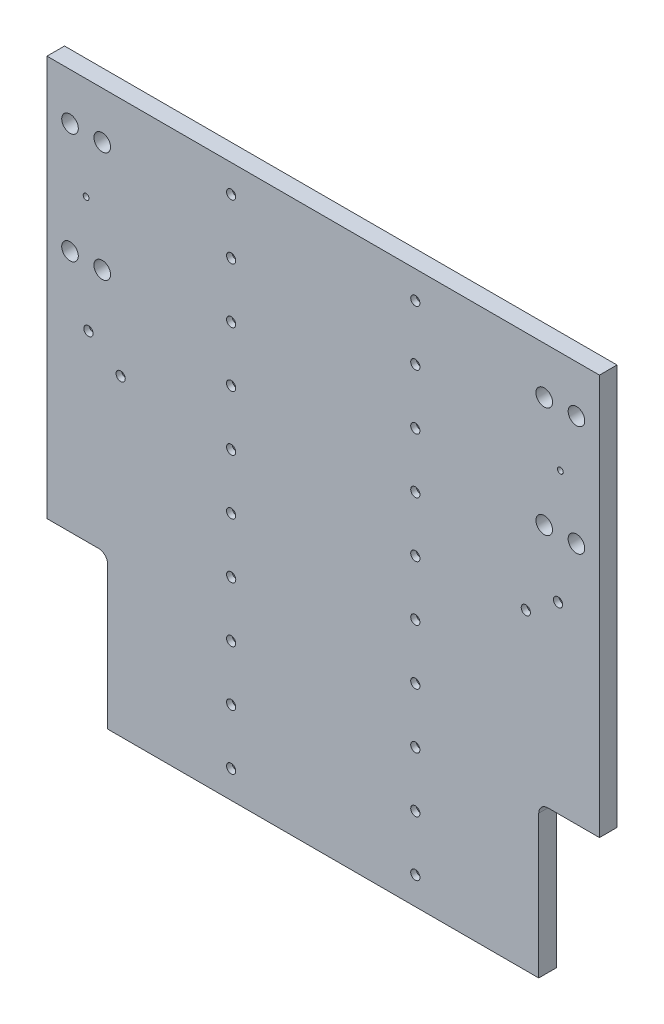
from build123d import *

# Parameters (mm, degrees)
SKETCH1_W                      = 600
SKETCH1_H                      = 600
BOSS_EXTRUDE1_DEPTH            = 19.05
SKETCH2_W                      = 65.95
SKETCH2_H                      = 165
CUT_EXTRUDE1_DEPTH             = 425.69153806
FILLET1_R                      = 10
CBORE_FOR_M5_SHCS1_D           = 5.5
CBORE_FOR_M5_SHCS1_DEPTH       = 28.347633298
CBORE_FOR_M5_SHCS1_CBORE_D     = 10
CBORE_FOR_M5_SHCS1_CBORE_DEPTH = 6
CBORE_FOR_M5_SHCS1_TIP         = 1.652366702
SKETCH5_R                      = 9.017
SKETCH5_R_2                    = 3.175
CUT_EXTRUDE2_DEPTH             = 425.69153806


with BuildPart() as part:
    # Sketch1 → Boss-Extrude1 (new body)
    with BuildSketch(Plane.XY):
        Rectangle(SKETCH1_W, SKETCH1_H)
    extrude(amount=BOSS_EXTRUDE1_DEPTH)

    # Sketch2 → Cut-Extrude1 (cut, through all)
    with BuildSketch(Plane(origin=(0, 0, 0), x_dir=(-1, 0, 0), z_dir=(0, 0, -1))):
        with Locations((267.025, -217.5)):
            Rectangle(SKETCH2_W, SKETCH2_H)
        with Locations((-267.025, -217.5)):
            Rectangle(SKETCH2_W, SKETCH2_H)
    extrude(amount=-CUT_EXTRUDE1_DEPTH, mode=Mode.SUBTRACT)

    # Fillet1
    fillet1_edges = [part.edges().sort_by_distance(p)[0] for p in [
        (-234.05, -135, 9.525),
        (234.05, -135, 9.525),
    ]]
    fillet(fillet1_edges, radius=FILLET1_R)

    # CBORE for M5 SHCS1
    with Locations(Plane.XY.offset(19.05)):
        with Locations((-100, 210), (-100, 270), (100, 270), (100, 210), (100, 150), (-100, 150), (-100, 90), (100, 90), (100, 30), (-100, 30), (-255, 64), (-220, 39), (255, 64), (220, 39), (100, -30), (-100, -30), (-100, -90), (100, -90), (100, -150), (-100, -150), (-100, -210), (100, -210), (100, -270), (-100, -270)):
            CounterBoreHole(CBORE_FOR_M5_SHCS1_D / 2, CBORE_FOR_M5_SHCS1_CBORE_D / 2, CBORE_FOR_M5_SHCS1_CBORE_DEPTH, depth=CBORE_FOR_M5_SHCS1_DEPTH)
            with Locations((0, 0, -(CBORE_FOR_M5_SHCS1_DEPTH + CBORE_FOR_M5_SHCS1_TIP / 2))):  # 118° drill point
                Cone(0, CBORE_FOR_M5_SHCS1_D / 2, CBORE_FOR_M5_SHCS1_TIP, mode=Mode.SUBTRACT)

    # Sketch5 → Cut-Extrude2 (cut, through all)
    with BuildSketch(Plane(origin=(0, 0, 0), x_dir=(-1, 0, 0), z_dir=(0, 0, -1))):
        with Locations((240, 249)):
            Circle(SKETCH5_R)
        with Locations((275, 249)):
            Circle(SKETCH5_R)
        with Locations((257.5, 189)):
            Circle(SKETCH5_R_2)
        with Locations((275, 129)):
            Circle(SKETCH5_R)
        with Locations((240, 129)):
            Circle(SKETCH5_R)
        with Locations((-275, 129)):
            Circle(SKETCH5_R)
        with Locations((-240, 129)):
            Circle(SKETCH5_R)
        with Locations((-257.5, 189)):
            Circle(SKETCH5_R_2)
        with Locations((-275, 249)):
            Circle(SKETCH5_R)
        with Locations((-240, 249)):
            Circle(SKETCH5_R)
    extrude(amount=-CUT_EXTRUDE2_DEPTH, mode=Mode.SUBTRACT)


solid = part.part
